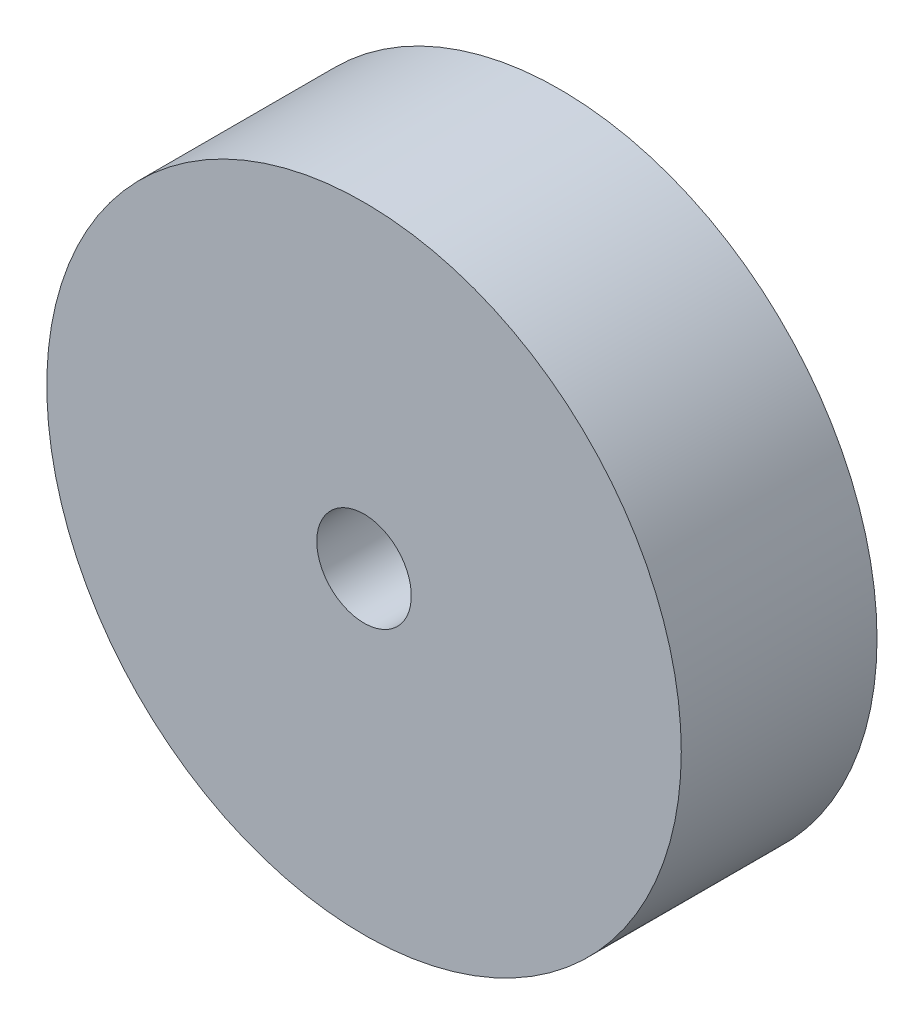
from build123d import *

# Parameters (mm, degrees)
SKETCH1_R           = 9.4
BOSS_EXTRUDE1_DEPTH = 5.8
SKETCH2_R           = 7.95
CUT_EXTRUDE1_DEPTH  = 3.2
SKETCH3_R           = 1
BOSS_EXTRUDE2_DEPTH = 1.5875
SKETCH4_R           = 3.7
BOSS_EXTRUDE3_DEPTH = 3
SKETCH5_R           = 1.4
CUT_EXTRUDE2_DEPTH  = 41.270506735
CHAMFER2_SIZE       = 1.477787454
CHAMFER2_SIZE_2     = 1.7


with BuildPart() as part:
    # Sketch1 → Boss-Extrude1 (new body)
    with BuildSketch(Plane.XY):
        with Locations((-29.082250471, -1.703826149)):
            Circle(SKETCH1_R)
    extrude(amount=BOSS_EXTRUDE1_DEPTH)

    # Sketch2 → Cut-Extrude1 (cut)
    with BuildSketch(Plane(origin=(0, 0, 0), x_dir=(-1, 0, 0), z_dir=(0, 0, -1))):
        with Locations((29.082250471, -1.703826149)):
            Circle(SKETCH2_R)
    extrude(amount=-CUT_EXTRUDE1_DEPTH, mode=Mode.SUBTRACT)

    # Sketch3 → Boss-Extrude2 (add)
    with BuildSketch(Plane(origin=(0, 0, 3.2), x_dir=(-1, 0, 0), z_dir=(0, 0, -1))):
        with Locations((29.082250471, -1.703826149)):
            Circle(SKETCH3_R)
    extrude(amount=BOSS_EXTRUDE2_DEPTH)

    # Sketch4 → Boss-Extrude3 (add)
    with BuildSketch(Plane(origin=(0, 0, 1.6125), x_dir=(-1, 0, 0), z_dir=(0, 0, -1))):
        with Locations((29.082250471, -1.703826149)):
            Circle(SKETCH4_R)
    extrude(amount=-BOSS_EXTRUDE3_DEPTH)

    # Sketch5 → Cut-Extrude2 (cut, through all)
    with BuildSketch(Plane(origin=(0, 0, 1.6125), x_dir=(-1, 0, 0), z_dir=(0, 0, -1))):
        with Locations((29.082250471, -1.703826149)):
            Circle(SKETCH5_R)
    extrude(amount=-CUT_EXTRUDE2_DEPTH, mode=Mode.SUBTRACT)

    # Chamfer2
    # the kernel refuses this chamfer: 1.7, 1.477787454 mm, written as the material it takes off along each edge
    with BuildSketch(Plane(origin=(-29.082250471, -1.703826149, 1.6125), x_dir=(-1, 0, 0), z_dir=(0, -1, 0))) as chamfer2_piece_1_section:
        Polygon((3.7 - CHAMFER2_SIZE, 0), (3.7, -CHAMFER2_SIZE_2), (3.7, 0), align=None)
    chamfer2_piece_1 = revolve(axis=Axis((-29.082250471, -1.703826149, 1.6125), (0, 0, -1)), mode=Mode.PRIVATE)
    chamfer2_piece_1 = split(chamfer2_piece_1, bisect_by=Plane(origin=(-26.169502039, -1.703826149, 3.2), z_dir=(0, 0, -1)), keep=Keep.TOP, mode=Mode.PRIVATE)
    add(chamfer2_piece_1, mode=Mode.SUBTRACT)


solid = part.part
